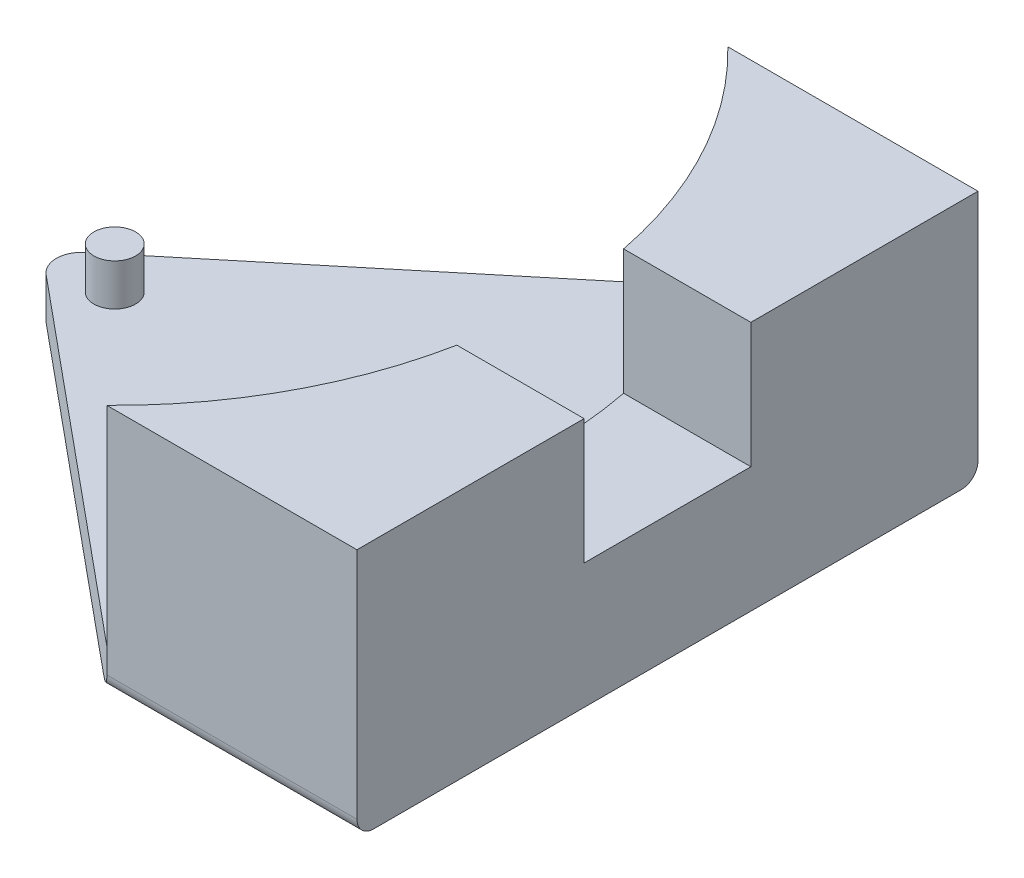
from build123d import *
from OCP.BRepFilletAPI import BRepFilletAPI_MakeFillet

# Parameters (mm, degrees)
BOSS_EXTRUDE1_DEPTH = 5
BOSS_EXTRUDE4_DEPTH = 25
SKETCH7_W           = 20
SKETCH7_H           = 15
CUT_EXTRUDE1_DEPTH  = 89.94906626
FILLET1_R1          = 2
FILLET1_R2          = 3
SKETCH8_R           = 2.5
BOSS_EXTRUDE6_DEPTH = 5


with BuildPart() as part:
    # Sketch1 → Boss-Extrude1 (new body)
    with BuildSketch(Plane(origin=(0, 0, 0), x_dir=(1, 0, 0), z_dir=(0, 1, 0))):
        Polygon((15, 37.241594872), (-15, 37.241594872), (-60, 0), (-15, -37.241594872), (15, -37.241594872), align=None)
    extrude(amount=BOSS_EXTRUDE1_DEPTH)

    # Sketch6 → Boss-Extrude4 (add)
    with BuildSketch(Plane(origin=(0, 5, 0), x_dir=(1, 0, 0), z_dir=(0, 1, 0))):
        with BuildLine():
            Line((-15, 37.241594872), (15, 37.241594872))
            Line((15, 37.241594872), (15, -37.241594872))
            Line((15, -37.241594872), (-15, -37.241594872))
            ThreePointArc((-15, -37.241594872), (0.708628967, 0), (-15, 37.241594872))
        make_face()
    extrude(amount=BOSS_EXTRUDE4_DEPTH)

    # Sketch7 → Cut-Extrude1 (cut, through all)
    with BuildSketch(Plane(origin=(15, 0, 0), x_dir=(0, 0, -1), z_dir=(1, 0, 0))):
        with Locations((0, 22.5)):
            Rectangle(SKETCH7_W, SKETCH7_H)
    extrude(amount=-CUT_EXTRUDE1_DEPTH, mode=Mode.SUBTRACT)

    # Fillet1: one fillet with a radius per group of edges: ONE call of the kernel's fillet builder (fillet() takes one radius for all edges)
    fillet1_edges_1 = [part.edges().sort_by_distance(p)[0] for p in [
        (0, 0, 37.241594872),
        (0, 0, -37.241594872),
    ]]
    fillet1_edges_2 = [part.edges().sort_by_distance(p)[0] for p in [
        (-60, 2.5, 0),
    ]]
    fillet1 = BRepFilletAPI_MakeFillet(part.part.solid().wrapped)
    for e in fillet1_edges_1:
        fillet1.Add(FILLET1_R1, e.wrapped)
    for e in fillet1_edges_2:
        fillet1.Add(FILLET1_R2, e.wrapped)
    add(Compound.cast(fillet1.Shape()), mode=Mode.REPLACE)

    # Sketch8 → Boss-Extrude6 (add)
    with BuildSketch(Plane(origin=(0, 5, 0), x_dir=(1, 0, 0), z_dir=(0, 1, 0))):
        with Locations((-51.291371033, 0)):
            Circle(SKETCH8_R)
    extrude(amount=BOSS_EXTRUDE6_DEPTH)


solid = part.part
